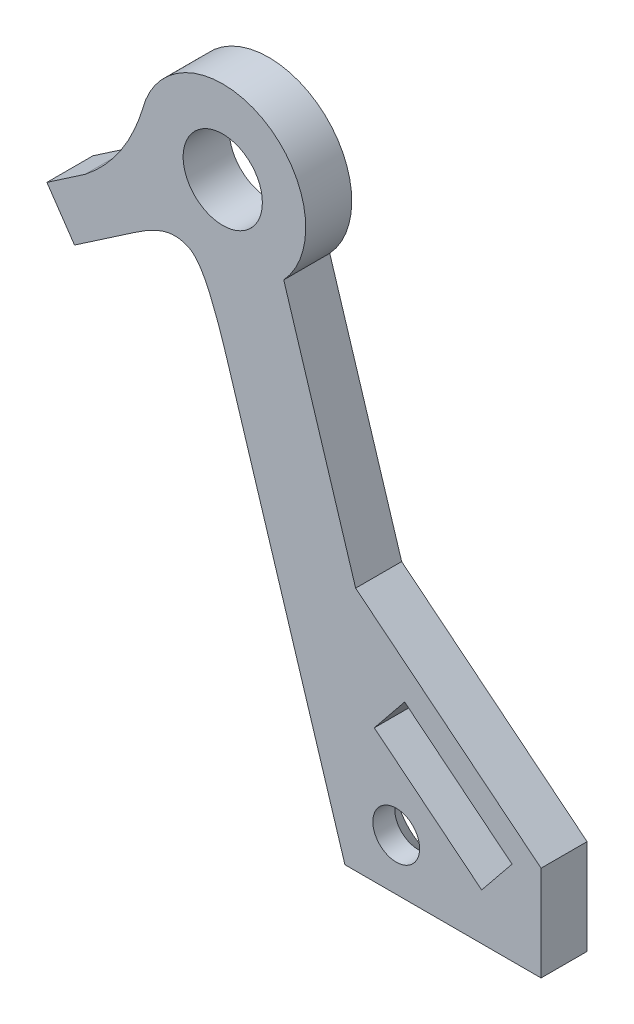
from build123d import *

# Parameters (mm, degrees)
SKETCH1_R           = 1.5
SKETCH1_R_2         = 2.625
BOSS_EXTRUDE1_DEPTH = 3.05


with BuildPart() as part:
    # Sketch1 → Boss-Extrude1 (new body)
    with BuildSketch(Plane.XY):
        with BuildLine():
            Line((-7.813226831, 25.104795624), (0, 0))
            Line((0, 0), (13, 0))
            Line((13, 0), (13, 6.303908615))
            Line((13, 6.303908615), (0.708529353, 16.231634907))
            Line((0.708529353, 16.231634907), (-4.057068102, 31.544047144))
            ThreePointArc((-4.057068102, 31.544047144), (-5.473136356, 40.107888765), (-13.427731373, 36.633834833))
            add(Edge.make_bspline(
                [(-17.229515242, 31.01562696), (-14.514237852, 33.142129435), (-13.427731373, 36.633834833)],
                knots=[0, 0, 0, 1, 1, 1], degree=2))
            Line((-17.229515242, 31.01562696), (-19.754600441, 29.293942889))
            Line((-19.754600441, 29.293942889), (-17.9237303, 26.608721385))
            Line((-17.9237303, 26.608721385), (-13.932796466, 29.329868067))
            add(Edge.make_bspline(
                [(-13.932796466, 29.329868067), (-12.381551692, 30.407849096), (-10.691589638, 30.789278346), (-9.223592818, 29.609717336), (-7.813226831, 25.104795624)],
                knots=[0, 0, 0, 0, 0.517103648, 1, 1, 1, 1], degree=3))
        make_face()
        with Locations((3.4, 3.4)):
            Circle(SKETCH1_R, mode=Mode.SUBTRACT)
        Polygon((11.073847559, 5.572751724), (9.110294099, 3.141685535), (9.063168816, 3.083339947), (1.945007017, 8.832624477), (3.95568576, 11.322036253), align=None, mode=Mode.SUBTRACT)
        with Locations((-8.098279353, 35.2748127)):
            Circle(SKETCH1_R_2, mode=Mode.SUBTRACT)
    extrude(amount=BOSS_EXTRUDE1_DEPTH)

    # Sketch3 → CSK for M3 Flat Head Machine Screw1 (revolve, cut)
    with BuildSketch(Plane(origin=(3.4, 3.4, 3.05), x_dir=(0, -1, 0), z_dir=(1, 0, 0))):
        Polygon((0, 0), (0, 3.05), (1.55, 3.05), (1.55, 1.6), (3.15, 0), align=None)
    revolve(axis=Axis((3.4, 3.4, 9.4), (0, 0, -1)), mode=Mode.SUBTRACT)


with BuildPart() as body_2:
    # Mirror1: mirrored copy
    add(part.part.mirror(Plane.XY))


solid = body_2.part
